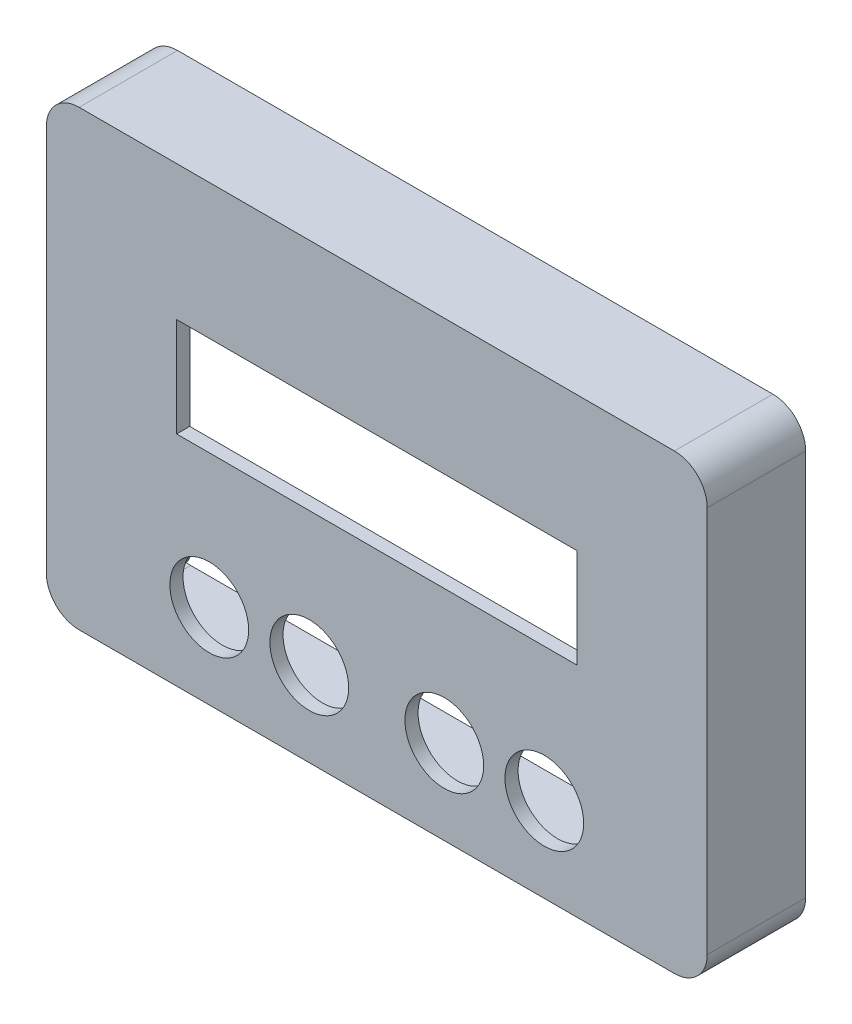
from build123d import *

# Parameters (mm, degrees)
SKETCH7_W           = 100.71
SKETCH7_H           = 68.96
BOSS_EXTRUDE2_DEPTH = 15
SKETCH8_R           = 6
SKETCH8_W           = 61
SKETCH8_H           = 15.1
CUT_EXTRUDE1_DEPTH  = 5
SKETCH9_W           = 96.71
SKETCH9_H           = 64.96
CUT_EXTRUDE2_DEPTH  = 13
SKETCH10_R          = 3
SKETCH10_R_2        = 1.5
BOSS_EXTRUDE4_DEPTH = 8
THREAD1_PITCH       = 0.5
THREAD2_PITCH       = 0.5
THREAD3_PITCH       = 0.5
THREAD4_PITCH       = 0.5
FILLET1_R           = 5


with BuildPart() as part:
    # Sketch7 → Boss-Extrude2 (new body)
    with BuildSketch(Plane.XY):
        with Locations((46.355, 30.48)):
            Rectangle(SKETCH7_W, SKETCH7_H)
    extrude(amount=BOSS_EXTRUDE2_DEPTH)

    # Sketch8 → Cut-Extrude1 (cut)
    with BuildSketch(Plane.XY.offset(15)):
        with Locations((20.828, 8.889)):
            Circle(SKETCH8_R)
        with Locations((36.068, 8.889)):
            Circle(SKETCH8_R)
        with Locations((56.642, 8.889)):
            Circle(SKETCH8_R)
        with Locations((71.882, 8.889)):
            Circle(SKETCH8_R)
        with Locations((46.355, 36.83)):
            Rectangle(SKETCH8_W, SKETCH8_H)
    extrude(amount=-CUT_EXTRUDE1_DEPTH, mode=Mode.SUBTRACT)

    # Sketch9 → Cut-Extrude2 (cut)
    with BuildSketch(Plane(origin=(0, 0, 0), x_dir=(-1, 0, 0), z_dir=(0, 0, -1))):
        with Locations((-46.355, 30.48)):
            Rectangle(SKETCH9_W, SKETCH9_H)
    extrude(amount=-CUT_EXTRUDE2_DEPTH, mode=Mode.SUBTRACT)

    # Sketch10 → Boss-Extrude4 (add)
    # profile 1 of 4: a face of its own
    with BuildSketch(Plane(origin=(0, 0, 13), x_dir=(-1, 0, 0), z_dir=(0, 0, -1))):
        with Locations((-5.08, 55.88)):
            Circle(SKETCH10_R)
        with Locations((-5.08, 55.88)):
            Circle(SKETCH10_R_2, mode=Mode.SUBTRACT)
    # profile 2 of 4: a face of its own
    with BuildSketch(Plane(origin=(0, 0, 13), x_dir=(-1, 0, 0), z_dir=(0, 0, -1))):
        with Locations((-87.63, 55.88)):
            Circle(SKETCH10_R)
        with Locations((-87.63, 55.88)):
            Circle(SKETCH10_R_2, mode=Mode.SUBTRACT)
    # profile 3 of 4: a face of its own
    with BuildSketch(Plane(origin=(0, 0, 13), x_dir=(-1, 0, 0), z_dir=(0, 0, -1))):
        with Locations((-5.08, 5.08)):
            Circle(SKETCH10_R)
        with Locations((-5.08, 5.08)):
            Circle(SKETCH10_R_2, mode=Mode.SUBTRACT)
    # profile 4 of 4: a face of its own
    with BuildSketch(Plane(origin=(0, 0, 13), x_dir=(-1, 0, 0), z_dir=(0, 0, -1))):
        with Locations((-87.63, 5.08)):
            Circle(SKETCH10_R)
        with Locations((-87.63, 5.08)):
            Circle(SKETCH10_R_2, mode=Mode.SUBTRACT)
    extrude(amount=BOSS_EXTRUDE4_DEPTH)

    # Thread1: arcs per turn and ends read off the stored shape
    # Thread1: the profile of Thread Profile2 profile screwed along a right-hand helix through 16 turns, 6 arcs to a turn; built about Z, then put on its axis
    thread1_z = Axis((0, 0, 0), (0, 0, 1))
    thread1_corners = [(1.5003, 0, -0.000173205), (1.5003, 0, 0.437673204), (1.229367063, 0, 0.281249999), (1.229367063, 0, 0.156249999)]
    with BuildLine(mode=Mode.PRIVATE) as thread1_profile:
        Line(thread1_corners[0], thread1_corners[1])
        Line(thread1_corners[1], thread1_corners[2])
        Line(thread1_corners[2], thread1_corners[3])
        Line(thread1_corners[3], thread1_corners[0])
    thread1_cap = Face(thread1_profile.wire())
    thread1_turn_angles = [0, 30, 60, 90, 120, 150, 180, 210, 240, 270, 300, 330, 360]
    thread1_turn_weights = [1, 0.8660254037844387, 1, 0.8660254037844387, 1, 0.8660254037844387, 1, 0.8660254037844387, 1, 0.8660254037844387, 1, 0.8660254037844387, 1]
    thread1_turn_rails = [Edge.make_bspline([Vector(p[0], p[1], 0).rotate(thread1_z, thread1_turn_angles[k]) / thread1_turn_weights[k] + Vector(0, 0, p[2] + THREAD1_PITCH * thread1_turn_angles[k] / 360) for k in range(13)], [0, 0, 0, 1, 1, 2, 2, 3, 3, 4, 4, 5, 5, 6, 6, 6], 2, thread1_turn_weights) for p in thread1_corners]
    thread1_turn_sides = [Face.make_surface_from_curves(thread1_turn_rails[p[0]], thread1_turn_rails[p[1]]) for p in [(0, 1), (1, 2), (2, 3), (3, 0)]]
    thread1 = Plane(origin=(87.63, 55.88, 5), x_dir=(1, 0, 0), z_dir=(0, 0, 1)) * Solid(Shell([*[p.moved(Location((0, 0, THREAD1_PITCH * i))) for i in range(16) for p in thread1_turn_sides], thread1_cap, thread1_cap.rotate(thread1_z, 5760).moved(Location((0, 0, THREAD1_PITCH * 5760 / 360)))]))
    add(thread1)

    # Thread2: arcs per turn and ends read off the stored shape
    # Thread2: the profile of Thread Profile3 profile screwed along a right-hand helix through 16 turns, 6 arcs to a turn; built about Z, then put on its axis
    thread2_z = Axis((0, 0, 0), (0, 0, 1))
    thread2_corners = [(1.5003, 0, -0.000173205), (1.5003, 0, 0.437673204), (1.229367063, 0, 0.281249999), (1.229367063, 0, 0.156249999)]
    with BuildLine(mode=Mode.PRIVATE) as thread2_profile:
        Line(thread2_corners[0], thread2_corners[1])
        Line(thread2_corners[1], thread2_corners[2])
        Line(thread2_corners[2], thread2_corners[3])
        Line(thread2_corners[3], thread2_corners[0])
    thread2_cap = Face(thread2_profile.wire())
    thread2_turn_angles = [0, 30, 60, 90, 120, 150, 180, 210, 240, 270, 300, 330, 360]
    thread2_turn_weights = [1, 0.8660254037844387, 1, 0.8660254037844387, 1, 0.8660254037844387, 1, 0.8660254037844387, 1, 0.8660254037844387, 1, 0.8660254037844387, 1]
    thread2_turn_rails = [Edge.make_bspline([Vector(p[0], p[1], 0).rotate(thread2_z, thread2_turn_angles[k]) / thread2_turn_weights[k] + Vector(0, 0, p[2] + THREAD2_PITCH * thread2_turn_angles[k] / 360) for k in range(13)], [0, 0, 0, 1, 1, 2, 2, 3, 3, 4, 4, 5, 5, 6, 6, 6], 2, thread2_turn_weights) for p in thread2_corners]
    thread2_turn_sides = [Face.make_surface_from_curves(thread2_turn_rails[p[0]], thread2_turn_rails[p[1]]) for p in [(0, 1), (1, 2), (2, 3), (3, 0)]]
    thread2 = Plane(origin=(5.08, 55.88, 5), x_dir=(1, 0, 0), z_dir=(0, 0, 1)) * Solid(Shell([*[p.moved(Location((0, 0, THREAD2_PITCH * i))) for i in range(16) for p in thread2_turn_sides], thread2_cap, thread2_cap.rotate(thread2_z, 5760).moved(Location((0, 0, THREAD2_PITCH * 5760 / 360)))]))
    add(thread2)

    # Thread3: arcs per turn and ends read off the stored shape
    # Thread3: the profile of Thread Profile4 profile screwed along a right-hand helix through 16 turns, 6 arcs to a turn; built about Z, then put on its axis
    thread3_z = Axis((0, 0, 0), (0, 0, 1))
    thread3_corners = [(1.5003, 0, -0.000173205), (1.5003, 0, 0.437673204), (1.229367063, 0, 0.281249999), (1.229367063, 0, 0.156249999)]
    with BuildLine(mode=Mode.PRIVATE) as thread3_profile:
        Line(thread3_corners[0], thread3_corners[1])
        Line(thread3_corners[1], thread3_corners[2])
        Line(thread3_corners[2], thread3_corners[3])
        Line(thread3_corners[3], thread3_corners[0])
    thread3_cap = Face(thread3_profile.wire())
    thread3_turn_angles = [0, 30, 60, 90, 120, 150, 180, 210, 240, 270, 300, 330, 360]
    thread3_turn_weights = [1, 0.8660254037844387, 1, 0.8660254037844387, 1, 0.8660254037844387, 1, 0.8660254037844387, 1, 0.8660254037844387, 1, 0.8660254037844387, 1]
    thread3_turn_rails = [Edge.make_bspline([Vector(p[0], p[1], 0).rotate(thread3_z, thread3_turn_angles[k]) / thread3_turn_weights[k] + Vector(0, 0, p[2] + THREAD3_PITCH * thread3_turn_angles[k] / 360) for k in range(13)], [0, 0, 0, 1, 1, 2, 2, 3, 3, 4, 4, 5, 5, 6, 6, 6], 2, thread3_turn_weights) for p in thread3_corners]
    thread3_turn_sides = [Face.make_surface_from_curves(thread3_turn_rails[p[0]], thread3_turn_rails[p[1]]) for p in [(0, 1), (1, 2), (2, 3), (3, 0)]]
    thread3 = Plane(origin=(87.63, 5.08, 5), x_dir=(1, 0, 0), z_dir=(0, 0, 1)) * Solid(Shell([*[p.moved(Location((0, 0, THREAD3_PITCH * i))) for i in range(16) for p in thread3_turn_sides], thread3_cap, thread3_cap.rotate(thread3_z, 5760).moved(Location((0, 0, THREAD3_PITCH * 5760 / 360)))]))
    add(thread3)

    # Thread4: arcs per turn and ends read off the stored shape
    # Thread4: the profile of Thread Profile5 profile screwed along a right-hand helix through 16 turns, 6 arcs to a turn; built about Z, then put on its axis
    thread4_z = Axis((0, 0, 0), (0, 0, 1))
    thread4_corners = [(1.5003, 0, -0.000173205), (1.5003, 0, 0.437673204), (1.229367063, 0, 0.281249999), (1.229367063, 0, 0.156249999)]
    with BuildLine(mode=Mode.PRIVATE) as thread4_profile:
        Line(thread4_corners[0], thread4_corners[1])
        Line(thread4_corners[1], thread4_corners[2])
        Line(thread4_corners[2], thread4_corners[3])
        Line(thread4_corners[3], thread4_corners[0])
    thread4_cap = Face(thread4_profile.wire())
    thread4_turn_angles = [0, 30, 60, 90, 120, 150, 180, 210, 240, 270, 300, 330, 360]
    thread4_turn_weights = [1, 0.8660254037844387, 1, 0.8660254037844387, 1, 0.8660254037844387, 1, 0.8660254037844387, 1, 0.8660254037844387, 1, 0.8660254037844387, 1]
    thread4_turn_rails = [Edge.make_bspline([Vector(p[0], p[1], 0).rotate(thread4_z, thread4_turn_angles[k]) / thread4_turn_weights[k] + Vector(0, 0, p[2] + THREAD4_PITCH * thread4_turn_angles[k] / 360) for k in range(13)], [0, 0, 0, 1, 1, 2, 2, 3, 3, 4, 4, 5, 5, 6, 6, 6], 2, thread4_turn_weights) for p in thread4_corners]
    thread4_turn_sides = [Face.make_surface_from_curves(thread4_turn_rails[p[0]], thread4_turn_rails[p[1]]) for p in [(0, 1), (1, 2), (2, 3), (3, 0)]]
    thread4 = Plane(origin=(5.08, 5.08, 5), x_dir=(1, 0, 0), z_dir=(0, 0, 1)) * Solid(Shell([*[p.moved(Location((0, 0, THREAD4_PITCH * i))) for i in range(16) for p in thread4_turn_sides], thread4_cap, thread4_cap.rotate(thread4_z, 5760).moved(Location((0, 0, THREAD4_PITCH * 5760 / 360)))]))
    add(thread4)

    # Fillet1
    fillet1_edges = [part.edges().sort_by_distance(p)[0] for p in [
        (94.71, -2, 6.5),
        (94.71, 62.96, 6.5),
        (-2, 62.96, 6.5),
        (-2, -2, 6.5),
        (-4, 64.96, 7.5),
        (96.71, 64.96, 7.5),
        (96.71, -4, 7.5),
        (-4, -4, 7.5),
    ]]
    fillet(fillet1_edges, radius=FILLET1_R)


solid = part.part
